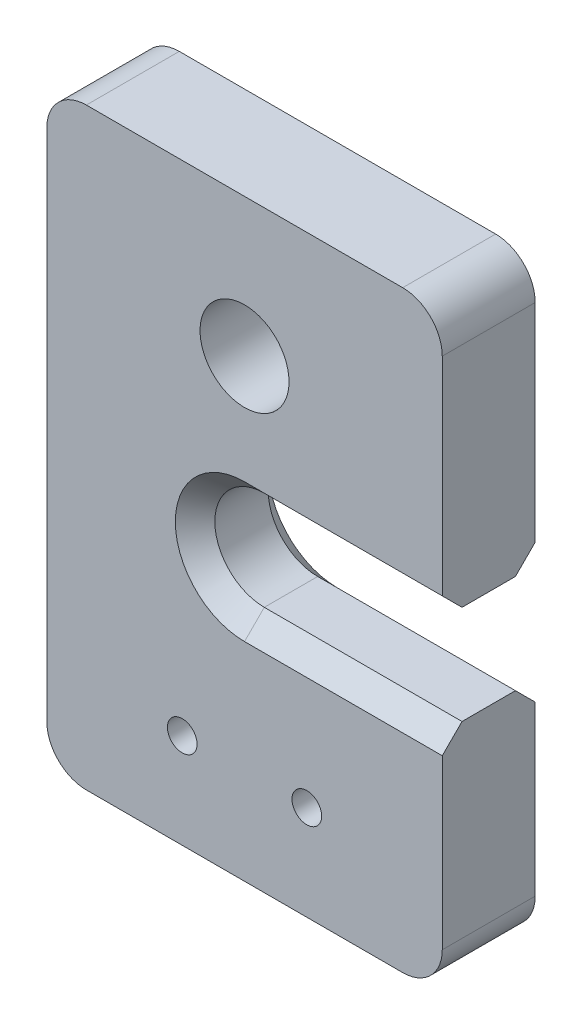
from build123d import *

# Parameters (mm, degrees)
SKETCH1_R           = 2.25
SKETCH1_R_2         = 0.75
BOSS_EXTRUDE1_DEPTH = 4.7
CUT_EXTRUDE1_DEPTH  = 37.360555551
CHAMFER1_SIZE       = 1


with BuildPart() as part:
    # Sketch1 → Boss-Extrude1 (new body)
    with BuildSketch(Plane.XY):
        with BuildLine():
            Line((2, 0), (18, 0))
            ThreePointArc((18, 0), (19.414213562, 0.585786438), (20, 2))
            Line((20, 2), (20, 28))
            ThreePointArc((20, 28), (19.414213562, 29.414213562), (18, 30))
            Line((18, 30), (2, 30))
            ThreePointArc((2, 30), (0.585786438, 29.414213562), (0, 28))
            Line((0, 28), (0, 2))
            ThreePointArc((0, 2), (0.585786438, 0.585786438), (2, 0))
        make_face()
        with Locations((10, 23)):
            Circle(SKETCH1_R, mode=Mode.SUBTRACT)
        with Locations((6.85, 4.8)):
            Circle(SKETCH1_R_2, mode=Mode.SUBTRACT)
        with Locations((13.15, 4.8)):
            Circle(SKETCH1_R_2, mode=Mode.SUBTRACT)
    extrude(amount=BOSS_EXTRUDE1_DEPTH)

    # Sketch2 → Cut-Extrude1 (cut, through all)
    with BuildSketch(Plane.XY.offset(4.7)):
        with BuildLine():
            Line((20, 16.5), (10, 16.5))
            ThreePointArc((10, 16.5), (7.5, 14), (10, 11.5))
            Line((10, 11.5), (20, 11.5))
            Line((20, 11.5), (20, 16.5))
        make_face()
    extrude(amount=-CUT_EXTRUDE1_DEPTH, mode=Mode.SUBTRACT)

    # Chamfer1
    chamfer1_edges = [part.edges().sort_by_distance(p)[0] for p in [
        (15, 16.5, 0),
        (7.5, 14, 0),
        (15, 11.5, 0),
        (15, 11.5, 4.7),
        (7.5, 14, 4.7),
        (15, 16.5, 4.7),
    ]]
    chamfer(chamfer1_edges, length=CHAMFER1_SIZE)


solid = part.part
